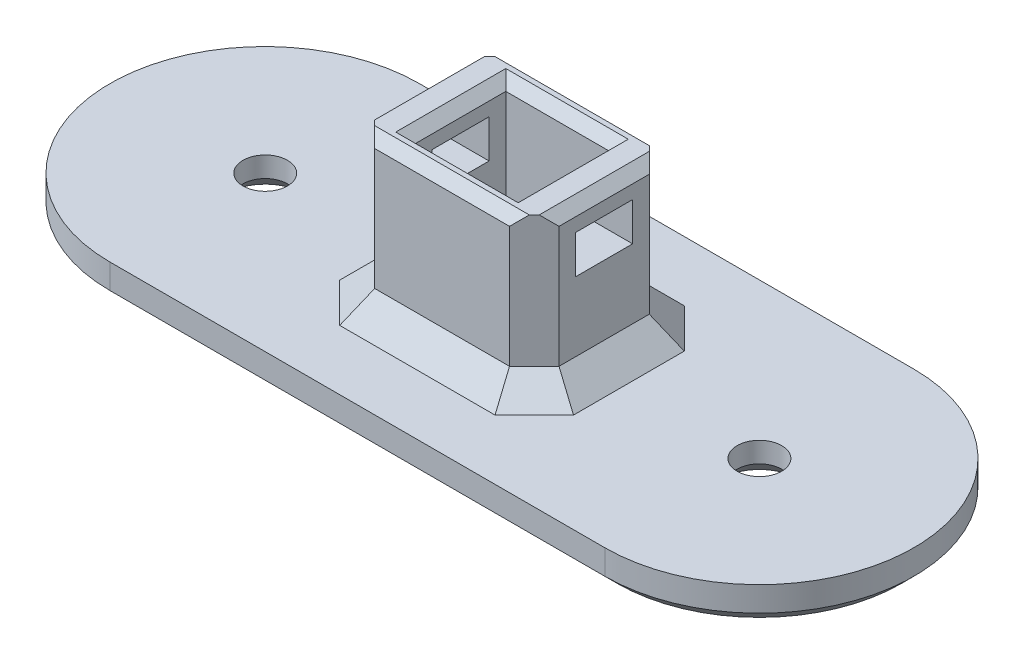
from build123d import *

# Parameters (mm, degrees)
SKETCH2_W                                       = 14.9
SKETCH2_H                                       = 11.3
SKETCH2_W_2                                     = 8.3
SKETCH2_H_2                                     = 7.3
BOSS_EXTRUDE1_DEPTH                             = 12.6
CUT_EXTRUDE1_DEPTH                              = 16.212659202
CUT_EXTRUDE1_DEPTH_BACK                         = 16.212659202
SKETCH4_W                                       = 4.6
SKETCH4_H                                       = 3.1
BOSS_EXTRUDE2_DEPTH                             = 3
CHAMFER1_SIZE                                   = 1
CHAMFER2_SIZE                                   = 0.8
CHAMFER3_SIZE                                   = 2
CSK_FOR_M3_FLAT_HEAD_MACHINE_SCREW1_D           = 3.6
CSK_FOR_M3_FLAT_HEAD_MACHINE_SCREW1_CSINK_D     = 6.3
CSK_FOR_M3_FLAT_HEAD_MACHINE_SCREW1_CSINK_ANGLE = 90
CHAMFER4_SIZE                                   = 2


with BuildPart() as part:
    # Sketch2 → Boss-Extrude1 (new body)
    with BuildSketch(Plane.XZ.offset(-12)):
        Rectangle(SKETCH2_W, SKETCH2_H)
        Rectangle(SKETCH2_W_2, SKETCH2_H_2, mode=Mode.SUBTRACT)
    extrude(amount=BOSS_EXTRUDE1_DEPTH)

    # Sketch4 → Cut-Extrude1 (cut, two sides: drawn at the far end of the back side and taken through both)
    with BuildSketch(Plane(origin=(0, 0, 0), x_dir=(0, 0, -1), z_dir=(1, 0, 0)).offset(-CUT_EXTRUDE1_DEPTH_BACK)):
        with Locations((0, 8.55)):
            Rectangle(SKETCH4_W, SKETCH4_H)
    extrude(amount=CUT_EXTRUDE1_DEPTH + CUT_EXTRUDE1_DEPTH_BACK, mode=Mode.SUBTRACT)

    # Sketch5 → Boss-Extrude2 (add)
    with BuildSketch(Plane.XZ.offset(0.6)):
        with BuildLine():
            Line((-20, 12.5), (20, 12.5))
            ThreePointArc((20, 12.5), (32.5, 0), (20, -12.5))
            Line((20, -12.5), (-20, -12.5))
            ThreePointArc((-20, -12.5), (-32.5, 0), (-20, 12.5))
        make_face()
    extrude(amount=BOSS_EXTRUDE2_DEPTH)

    # Chamfer1
    chamfer1_edges = [part.edges().sort_by_distance(p)[0] for p in [
        (-32.5, -3.6, 0),
        (0, -3.6, -12.5),
        (32.5, -3.6, 0),
        (0, -3.6, 12.5),
    ]]
    chamfer(chamfer1_edges, length=CHAMFER1_SIZE)

    # Chamfer2
    chamfer2_edges = [part.edges().sort_by_distance(p)[0] for p in [
        (0, 12, -3.65),
        (4.15, 12, 0),
        (0, 12, 3.65),
        (-4.15, 12, 0),
        (0, 12, -5.65),
        (-7.45, 12, 0),
        (0, 12, 5.65),
        (7.45, 12, 0),
    ]]
    chamfer(chamfer2_edges, length=CHAMFER2_SIZE)

    # Chamfer3
    # the kernel refuses this chamfer: 2 mm, written as the material it takes off along each edge
    with BuildSketch(Plane(origin=(-7.45, 16.343365976, 5.65), x_dir=(-0.027495876610586053, 0, -0.9996219169112968), z_dir=(0, -1, 0)), Plane(origin=(7.45, 16.343365976, 5.65), x_dir=(-0.9996219169112968, 0, 0.027495876610586487), z_dir=(0, -1, 0))) as chamfer3_piece_1:
        Polygon((CHAMFER3_SIZE * 0.999621916911, CHAMFER3_SIZE * 0.0274958766106), (-CHAMFER3_SIZE * 0.0274958766106, CHAMFER3_SIZE * 0.999621916911), (0, 0), align=None)
    extrude(amount=16.943365976, mode=Mode.SUBTRACT)
    with BuildSketch(Plane(origin=(-7.45, 16.343365976, -5.65), x_dir=(-0.027495876610586924, 0, 0.9996219169112968), z_dir=(0, -1, 0)), Plane(origin=(7.45, 16.343365976, -5.65), x_dir=(-0.9996219169112968, 0, -0.027495876610586487), z_dir=(0, -1, 0))) as chamfer3_piece_2:
        Polygon((CHAMFER3_SIZE * 0.999621916911, -CHAMFER3_SIZE * 0.0274958766106), (-CHAMFER3_SIZE * 0.0274958766106, -CHAMFER3_SIZE * 0.999621916911), (0, 0), align=None)
    extrude(amount=16.943365976, mode=Mode.SUBTRACT)

    # CSK for M3 Flat Head Machine Screw1 (through all)
    with Locations(Plane(origin=(0, -3.6, 0), x_dir=(-1, 0, 0), z_dir=(0, -1, 0))):
        with Locations((-20, 0), (19.948852039, 0)):
            CounterSinkHole(CSK_FOR_M3_FLAT_HEAD_MACHINE_SCREW1_D / 2, CSK_FOR_M3_FLAT_HEAD_MACHINE_SCREW1_CSINK_D / 2, counter_sink_angle=CSK_FOR_M3_FLAT_HEAD_MACHINE_SCREW1_CSINK_ANGLE)

    # Chamfer4
    chamfer4_edges = [part.edges().sort_by_distance(p)[0] for p in [
        (-7.45, -0.6, 0),
        (0, -0.6, 5.65),
        (0, -0.6, -5.65),
        (7.45, -0.6, 0),
        (-6.45, -0.6, 4.65),
        (-6.45, -0.6, -4.65),
        (6.45, -0.6, -4.65),
        (6.45, -0.6, 4.65),
    ]]
    chamfer(chamfer4_edges, length=CHAMFER4_SIZE)


solid = part.part
